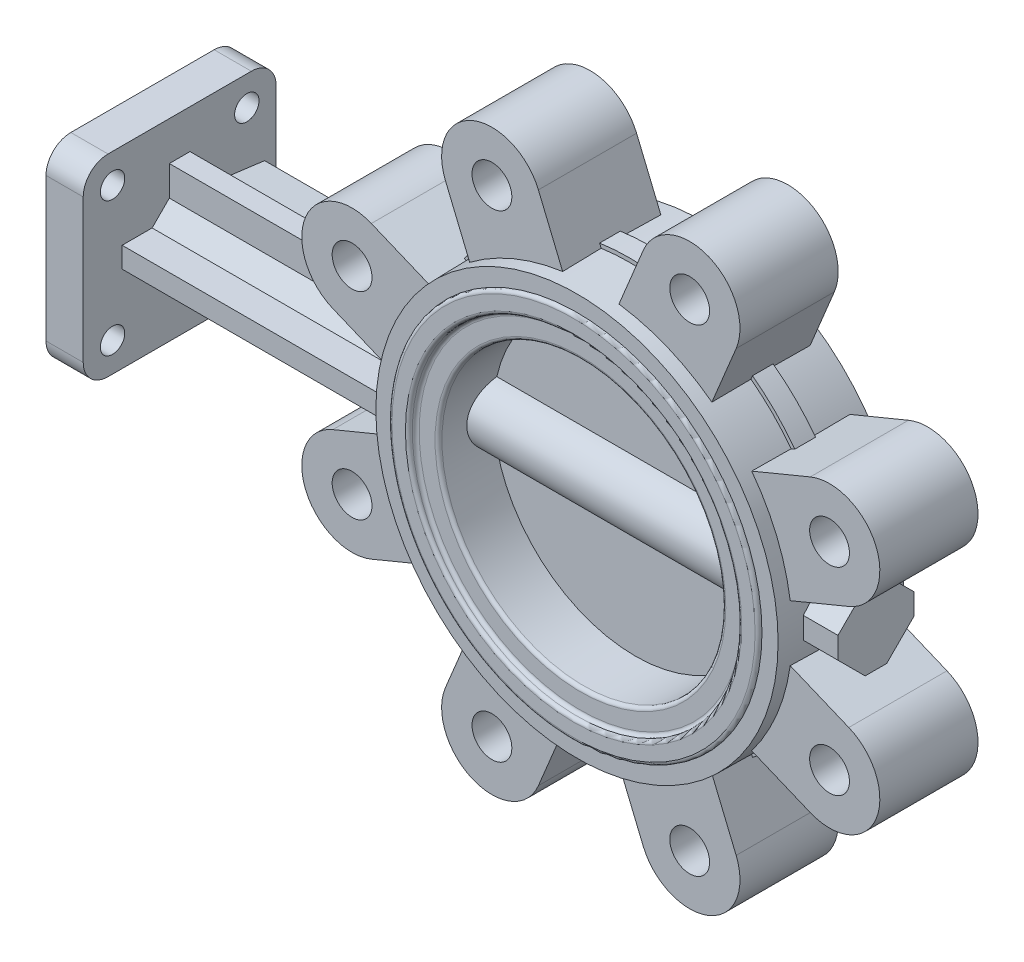
from build123d import *

# Parameters (mm, degrees)
SKETCH1_R                     = 74.549
BOSS_EXTRUDE1_DEPTH           = 23.19655
BOSS_EXTRUDE1_TAPER           = 1
BOSS_EXTRUDE1_OTHER_WAY_DEPTH = 23.19655
BOSS_EXTRUDE1_OTHER_WAY_TAPER = 1
SKETCH2_R                     = 68.199
BOSS_EXTRUDE2_DEPTH           = 1.27
BOSS_EXTRUDE3_START           = 1.27
SKETCH3_R                     = 68.199
BOSS_EXTRUDE3_DEPTH           = 1.27
SKETCH4_R                     = 60.706
CUT_EXTRUDE1_DEPTH            = 2.54
CUT_EXTRUDE2_START            = -2.54
SKETCH5_R                     = 60.706
CUT_EXTRUDE2_DEPTH            = 2.54
SKETCH6_R                     = 52.324
CUT_EXTRUDE3_DEPTH            = 116.184315596
SKETCH7_W                     = 6.35
SKETCH7_H                     = 7.62
SKETCH8_W                     = 27.94
SKETCH8_H                     = 27.94
BOSS_EXTRUDE4_DEPTH           = 18.796
CHAMFER1_SIZE                 = 10
BOSS_EXTRUDE5_DEPTH           = 93.726
BOSS_EXTRUDE5_DEPTH_BACK      = 12.7
SKETCH11_W                    = 71.12
SKETCH11_H                    = 71.12
BOSS_EXTRUDE7_DEPTH           = 13.716
CHAMFER2_SIZE                 = 6.35
FILLET1_R                     = 9.144
SKETCH12_W                    = 57.15
SKETCH12_H                    = 31.75
BOSS_EXTRUDE8_DEPTH           = 17.399
BOSS_EXTRUDE8_TAPER           = 4
FILLET2_R                     = 1.27
SKETCH14_R                    = 9.525
CUT_EXTRUDE5_DEPTH            = 7.62
M8_CLEARANCE_HOLE1_D          = 9
M8_CLEARANCE_HOLE1_DEPTH      = 13.716
SKETCH18_R                    = 11.5
BOSS_EXTRUDE9_DEPTH           = 142.24
SKETCH19_R                    = 7
BOSS_EXTRUDE10_DEPTH          = 6.62
BOSS_EXTRUDE11_DEPTH          = 19
CHAMFER3_SIZE                 = 1.5
SKETCH21_R                    = 52.324
BOSS_EXTRUDE12_DEPTH          = 1.665
BOSS_EXTRUDE13_DEPTH          = 18.0975
CIRPATTERN1_COUNT             = 8
F_5_8_18_TAPPED_HOLE1_D       = 14.68374


# Some blends are built 0.0001 mm under size
with BuildPart() as part:
    # Sketch1 → Boss-Extrude1 (new body)
    with BuildSketch(Plane.XY):
        Circle(SKETCH1_R)
    extrude(amount=BOSS_EXTRUDE1_DEPTH, taper=BOSS_EXTRUDE1_TAPER)

    # Sketch1 → Boss-Extrude1 other way (add)
    with BuildSketch(Plane.XY):
        Circle(SKETCH1_R)
    extrude(amount=-BOSS_EXTRUDE1_OTHER_WAY_DEPTH, taper=BOSS_EXTRUDE1_OTHER_WAY_TAPER)

    # Sketch2 → Boss-Extrude2 (add)
    with BuildSketch(Plane.XY.offset(23.19655)):
        Circle(SKETCH2_R)
    extrude(amount=BOSS_EXTRUDE2_DEPTH)

    # Sketch3 → Boss-Extrude3 (add)
    with BuildSketch(Plane(origin=(0, 0, -23.19655), x_dir=(-1, 0, 0), z_dir=(0, 0, -1)).offset(BOSS_EXTRUDE3_START)):
        with Locations(Location((0, 0, 0), (0, 0, 180))):
            Circle(SKETCH3_R)
    extrude(amount=-BOSS_EXTRUDE3_DEPTH)

    # Sketch4 → Cut-Extrude1 (cut)
    with BuildSketch(Plane(origin=(0, 0, -24.46655), x_dir=(-1, 0, 0), z_dir=(0, 0, -1))):
        Circle(SKETCH4_R)
    extrude(amount=-CUT_EXTRUDE1_DEPTH, mode=Mode.SUBTRACT)

    # Sketch5 → Cut-Extrude2 (cut)
    with BuildSketch(Plane.XY.offset(24.46655).offset(CUT_EXTRUDE2_START)):
        with Locations(Location((0, 0, 0), (0, 0, 180))):
            Circle(SKETCH5_R)
    extrude(amount=CUT_EXTRUDE2_DEPTH, mode=Mode.SUBTRACT)

    # Sketch6 → Cut-Extrude3 (cut, through all)
    with BuildSketch(Plane.XY.offset(21.92655)):
        Circle(SKETCH6_R)
    extrude(amount=-CUT_EXTRUDE3_DEPTH, mode=Mode.SUBTRACT)

    # Sketch7 → Revolve1 (revolve)
    with BuildSketch(Plane(origin=(0, 0, 0), x_dir=(1, 0, 0), z_dir=(0, 1, 0)), mode=Mode.PRIVATE) as revolve1_sk:
        with Locations((-72.747102714, 0)):
            Rectangle(SKETCH7_W, SKETCH7_H)
    revolve(revolve1_sk.sketch.rotate(Axis((0, 0, 0), (0, 0, -1)), 180), axis=Axis((0, 0, 0), (0, 0, -1)))

    # Sketch8 → Boss-Extrude4 (add)
    with BuildSketch(Plane(origin=(68.199, 0, 0), x_dir=(0, 0, -1), z_dir=(1, 0, 0))):
        Rectangle(SKETCH8_W, SKETCH8_H)
    extrude(amount=BOSS_EXTRUDE4_DEPTH)

    # Chamfer1
    chamfer1_edges = [part.edges().sort_by_distance(p)[0] for p in [
        (79.987549411, 13.97, -13.97),
        (79.987549411, -13.97, -13.97),
        (79.987549411, -13.97, 13.97),
        (79.987549411, 13.97, 13.97),
    ]]
    chamfer(chamfer1_edges, length=CHAMFER1_SIZE)

    # Sketch9 → Boss-Extrude5 (add, two sides: drawn at the far end of the back side and taken through both)
    with BuildSketch(Plane.ZY.offset(75.922102714).offset(-BOSS_EXTRUDE5_DEPTH_BACK)):
        Polygon((-21.209, 3.81), (-3.81, 3.81), (-3.81, 21.209), (3.81, 21.209), (3.81, 3.81), (21.209, 3.81), (21.209, -3.81), (3.81, -3.81), (3.81, -21.209), (-3.81, -21.209), (-3.81, -3.81), (-21.209, -3.81), align=None)
    extrude(amount=BOSS_EXTRUDE5_DEPTH + BOSS_EXTRUDE5_DEPTH_BACK)

    # Sketch11 → Boss-Extrude7 (add)
    with BuildSketch(Plane.ZY.offset(169.648102714)):
        Rectangle(SKETCH11_W, SKETCH11_H)
    extrude(amount=BOSS_EXTRUDE7_DEPTH)

    # Chamfer2
    chamfer2_edges = [part.edges().sort_by_distance(p)[0] for p in [
        (-122.016544351, 3.81, 3.81),
        (-122.016544351, -3.81, 3.81),
        (-122.016544351, -3.81, -3.81),
        (-122.016544351, 3.81, -3.81),
    ]]
    chamfer(chamfer2_edges, length=CHAMFER2_SIZE)

    # Fillet1
    fillet1_edges = [part.edges().sort_by_distance(p)[0] for p in [
        (-176.506102714, 35.56, -35.56),
        (-176.506102714, -35.56, -35.56),
        (-176.506102714, -35.56, 35.56),
        (-176.506102714, 35.56, 35.56),
    ]]
    fillet(fillet1_edges, radius=FILLET1_R)

    # Sketch12 → Boss-Extrude8 (add)
    with BuildSketch(Plane(origin=(0, 0, -3.81), x_dir=(-1, 0, 0), z_dir=(0, 0, -1))):
        with Locations((132.183102714, 0)):
            Rectangle(SKETCH12_W, SKETCH12_H)
    extrude(amount=BOSS_EXTRUDE8_DEPTH, taper=BOSS_EXTRUDE8_TAPER)

    # Fillet2
    fillet2_edges = [part.edges().sort_by_distance(p)[0] for p in [
        (-68.199, 0, 24.46655),
        (-68.199, 0, -24.46655),
        (60.706, 0, -24.46655),
        (60.706, 0, 21.92655),
        (60.706, 0, 24.46655),
        (-52.324, 0, -21.92655),
        (-52.324, 0, 21.92655),
    ]]
    fillet(fillet2_edges, radius=FILLET2_R - 0.0001)  # a hair under: the kernel refuses the full size

    # Sketch14 → Cut-Extrude5 (cut)
    with BuildSketch(Plane.ZY.offset(183.364102714)):
        Circle(SKETCH14_R)
    extrude(amount=-CUT_EXTRUDE5_DEPTH, mode=Mode.SUBTRACT)

    # M8 Clearance Hole1
    with Locations(Plane.ZY.offset(183.364102714)):
        with Locations((-24.748737342, 24.748737342), (24.748737342, 24.748737342), (24.748737342, -24.748737342), (-24.748737342, -24.748737342)):
            Hole(M8_CLEARANCE_HOLE1_D / 2, depth=M8_CLEARANCE_HOLE1_DEPTH)

    # Sketch18 → Boss-Extrude9 (add)
    with BuildSketch(Plane(origin=(86.995, 0, 0), x_dir=(0, 0, -1), z_dir=(1, 0, 0))):
        Circle(SKETCH18_R)
    extrude(amount=-BOSS_EXTRUDE9_DEPTH)

    # Sketch19 → Boss-Extrude10 (add)
    with BuildSketch(Plane.ZY.offset(175.744102714)):
        with Locations(Location((0, 0, 0), (0, 0, 180))):
            Circle(SKETCH19_R)
    extrude(amount=BOSS_EXTRUDE10_DEPTH)

    # Sketch20 → Boss-Extrude11 (add)
    with BuildSketch(Plane.ZY.offset(182.364102714)):
        Polygon((0, 7.778174593), (-7.778174593, 0), (0, -7.778174593), (7.778174593, 0), align=None)
    extrude(amount=BOSS_EXTRUDE11_DEPTH)

    # Chamfer3
    # the kernel refuses this chamfer: 1.5 mm, written as the material it takes off along each edge
    with BuildSketch(Plane(origin=(-182.364102714, 0, 7.778174593), x_dir=(0, 0.7262819568766865, -0.6873969152646604), z_dir=(-1, 0, 0)), Plane(origin=(-182.364102714, 7.778174593, 0), x_dir=(0, -0.6873969152646582, -0.7262819568766886), z_dir=(-1, 0, 0)), Plane(origin=(-182.364102714, 0, -7.778174593), x_dir=(0, -0.7262819568766865, 0.6873969152646606), z_dir=(-1, 0, 0))) as chamfer3_piece_1:
        Polygon((CHAMFER3_SIZE * 0.999621916911, CHAMFER3_SIZE * 0.0274958766106), (-CHAMFER3_SIZE * 0.0274958766106, CHAMFER3_SIZE * 0.999621916911), (0, 0), align=None)
    extrude(amount=22.857524482, mode=Mode.SUBTRACT)
    with BuildSketch(Plane(origin=(-182.364102714, -7.778174593, 0), x_dir=(0, 0.6873969152646581, -0.7262819568766888), z_dir=(-1, 0, 0))) as chamfer3_piece_2:
        Polygon((CHAMFER3_SIZE * 0.999621916911, -CHAMFER3_SIZE * 0.0274958766106), (-CHAMFER3_SIZE * 0.0274958766106, -CHAMFER3_SIZE * 0.999621916911), (0, 0), align=None)
    extrude(amount=22.857524482, mode=Mode.SUBTRACT)

    # Sketch21 → Boss-Extrude12 (add, symmetric)
    with BuildSketch(Plane.XY):
        with Locations(Location((0, 0, 0), (0, 0, 347.439601599))):
            Circle(SKETCH21_R)
    extrude(amount=BOSS_EXTRUDE12_DEPTH, both=True)

    # Sketch22 → Boss-Extrude13 (add, symmetric)
    with BuildSketch(Plane.XY):
        with BuildLine():
            Line((-80.903809269, 53.581171225), (-59.227910214, 44.60271986))
            ThreePointArc((-59.227910214, 44.60271986), (-68.500218954, 28.373719716), (-73.41934262, 10.341571276))
            Line((-73.41934262, 10.341571276), (-95.095241675, 19.320022641))
            ThreePointArc((-95.095241675, 19.320022641), (-105.130099764, 43.546313136), (-80.903809269, 53.581171225))
        make_face()
    boss_extrude13 = extrude(amount=BOSS_EXTRUDE13_DEPTH, both=True)

    # CirPattern1: Boss-Extrude13 ×8 about axis
    cirpattern1_axis = Axis((0, 0, 0), (0, 0, 1))
    for i in range(1, CIRPATTERN1_COUNT):
        add(boss_extrude13.rotate(cirpattern1_axis, i * 360 / CIRPATTERN1_COUNT))

    # 5/8-18 Tapped Hole1 (through all)
    with Locations(Plane.XY.offset(18.0975)):
        with Locations((-87.999525472, -36.450596933), (-87.999525472, 36.450596933), (36.450596933, -87.999525472), (-36.450596933, -87.999525472), (87.999525472, -36.450596933), (87.999525472, 36.450596933), (36.450596933, 87.999525472), (-36.450596933, 87.999525472)):
            Hole(F_5_8_18_TAPPED_HOLE1_D / 2)


solid = part.part
